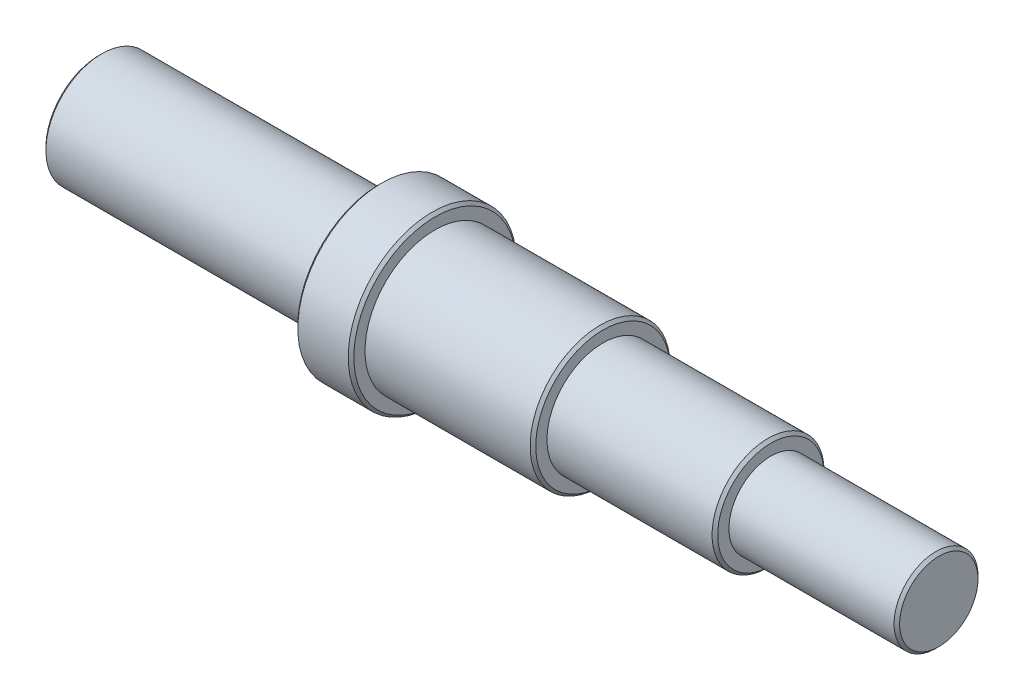
from build123d import *

# Parameters (mm, degrees)
SKETCH_1_R      = 10
EXTRUDE_1_DEPTH = 50
CHAMFER_1_SIZE  = 0.5
SKETCH_2_R      = 15
EXTRUDE_2_DEPTH = 10
CHAMFER_2_SIZE  = 0.5
CHAMFER_3_SIZE  = 0.5
SKETCH_3_R      = 12.5
EXTRUDE_3_DEPTH = 30
CHAMFER_4_SIZE  = 0.5
SKETCH_4_R      = 10
EXTRUDE_4_DEPTH = 30
CHAMFER_5_SIZE  = 0.5
SKETCH_5_R      = 7.5
EXTRUDE_5_DEPTH = 30
CHAMFER_6_SIZE  = 0.5


with BuildPart() as part:
    # 草图1 → 凸台-拉伸1 (new body)
    with BuildSketch(Plane(origin=(0, 0, 0), x_dir=(0, 0, -1), z_dir=(1, 0, 0))):
        Circle(SKETCH_1_R)
    extrude(amount=EXTRUDE_1_DEPTH)

    # 倒角1
    chamfer_1_edges = [part.edges().sort_by_distance(p)[0] for p in [
        (0, 0, 10),
    ]]
    chamfer(chamfer_1_edges, length=CHAMFER_1_SIZE)

    # 草图2 → 凸台-拉伸2 (add)
    with BuildSketch(Plane(origin=(50, 0, 0), x_dir=(0, 0, -1), z_dir=(1, 0, 0))):
        Circle(SKETCH_2_R)
    extrude(amount=EXTRUDE_2_DEPTH)

    # 倒角2
    chamfer_2_edges = [part.edges().sort_by_distance(p)[0] for p in [
        (50, 0, 15),
    ]]
    chamfer(chamfer_2_edges, length=CHAMFER_2_SIZE)

    # 倒角3
    chamfer_3_edges = [part.edges().sort_by_distance(p)[0] for p in [
        (60, 0, 15),
    ]]
    chamfer(chamfer_3_edges, length=CHAMFER_3_SIZE)

    # 草图3 → 凸台-拉伸3 (add)
    with BuildSketch(Plane(origin=(60, 0, 0), x_dir=(0, 0, -1), z_dir=(1, 0, 0))):
        Circle(SKETCH_3_R)
    extrude(amount=EXTRUDE_3_DEPTH)

    # 倒角4
    chamfer_4_edges = [part.edges().sort_by_distance(p)[0] for p in [
        (90, 0, 12.5),
    ]]
    chamfer(chamfer_4_edges, length=CHAMFER_4_SIZE)

    # 草图4 → 凸台-拉伸4 (add)
    with BuildSketch(Plane(origin=(90, 0, 0), x_dir=(0, 0, -1), z_dir=(1, 0, 0))):
        Circle(SKETCH_4_R)
    extrude(amount=EXTRUDE_4_DEPTH)

    # 倒角5
    chamfer_5_edges = [part.edges().sort_by_distance(p)[0] for p in [
        (120, 0, 10),
    ]]
    chamfer(chamfer_5_edges, length=CHAMFER_5_SIZE)

    # 草图5 → 凸台-拉伸5 (add)
    with BuildSketch(Plane(origin=(120, 0, 0), x_dir=(0, 0, -1), z_dir=(1, 0, 0))):
        Circle(SKETCH_5_R)
    extrude(amount=EXTRUDE_5_DEPTH)

    # 倒角6
    chamfer_6_edges = [part.edges().sort_by_distance(p)[0] for p in [
        (150, 0, 7.5),
    ]]
    chamfer(chamfer_6_edges, length=CHAMFER_6_SIZE)


solid = part.part
